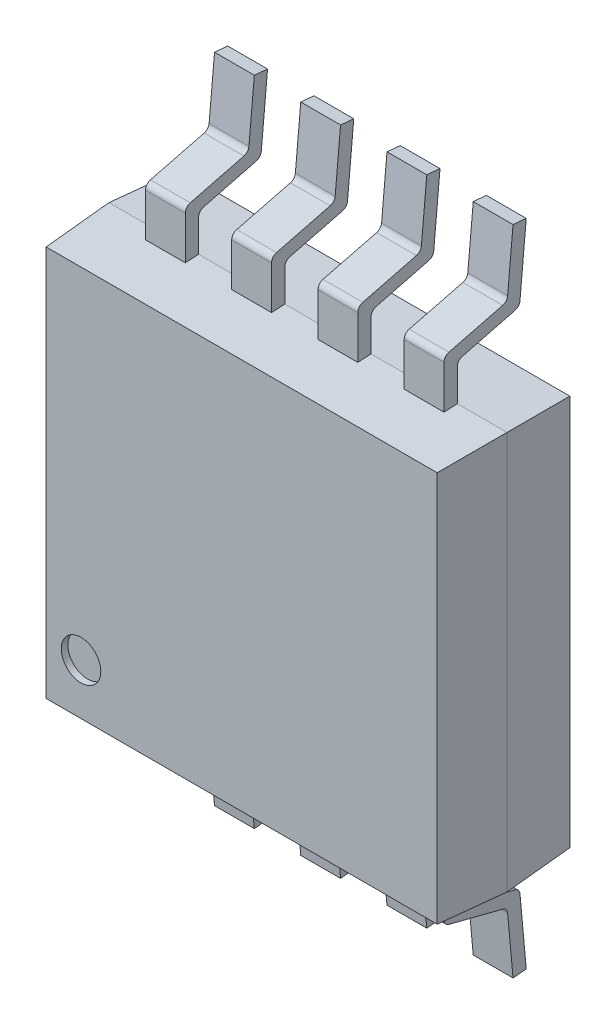
from build123d import *

# Parameters (mm, degrees)
SKETCH1_W              = 3
SKETCH1_H              = 3
BOSS_EXTRUDE1_DEPTH    = 0.5
BOSS_EXTRUDE1_TAPER    = 3
SKETCH2_W              = 3
SKETCH2_H              = 3
BOSS_EXTRUDE2_DEPTH    = 0.5
BOSS_EXTRUDE2_TAPER    = 3
EXTRUDE_THIN1_DEPTH    = 0.15
FILLET1_R              = 0.05
LPATTERN1_COUNT        = 4
LPATTERN1_PITCH        = 0.65
FILLET1_OF_LPATTERN1_R = 0.05
MIRROR1_START          = 0.375
MIRROR1_DEPTH          = 0.3
MIRROR1_START_2        = 1.025
MIRROR1_2_DEPTH        = 0.3
MIRROR1_START_3        = 1.675
MIRROR1_3_DEPTH        = 0.3
MIRROR1_START_4        = 2.325
MIRROR1_4_DEPTH        = 0.3
SKETCH4_R              = 0.14887785
CUT_EXTRUDE1_DEPTH     = 0.05


# Read off the part's stored shape, not the designer's step: Mirror1
with BuildPart() as part:
    # Sketch1 → Boss-Extrude1 (new body)
    with BuildSketch(Plane.XY):
        with Locations((1.5, 1.5)):
            Rectangle(SKETCH1_W, SKETCH1_H)
    extrude(amount=BOSS_EXTRUDE1_DEPTH, taper=BOSS_EXTRUDE1_TAPER)



with BuildPart() as body_2:
    # Sketch2 → Boss-Extrude2 (new body)
    with BuildSketch(Plane(origin=(0, 0, 0), x_dir=(-1, 0, 0), z_dir=(0, 0, -1))):
        with Locations((-1.5, 1.5)):
            Rectangle(SKETCH2_W, SKETCH2_H)
    extrude(amount=BOSS_EXTRUDE2_DEPTH, taper=BOSS_EXTRUDE2_TAPER)


with BuildPart() as part_1:
    add(part.part)

    add(body_2.part)  # Extrude-Thin1 merges body 2
    # Sketch3 → Extrude-Thin1 (add, symmetric)
    with BuildSketch(Plane(origin=(0.525, 0, 0), x_dir=(0, 0, -1), z_dir=(1, 0, 0))):
        Polygon((0, 0.090955067), (0, -0.280409021), (0.469567974, -0.4), (0.52, -0.95), (0.420417762, -0.959131153), (0.376435704, -0.479473015), (-0.1, -0.358132942), (-0.1, 0.090955067), align=None)
    extrude_thin1 = extrude(amount=EXTRUDE_THIN1_DEPTH, both=True)

    # Fillet1
    fillet1_edges = [part_1.edges().sort_by_distance(p)[0] for p in [
        (0.525, -0.280409021, 0),
        (0.525, -0.479473015, -0.376435704),
        (0.525, -0.4, -0.469567974),
        (0.525, -0.358132942, 0.1),
    ]]
    fillet(fillet1_edges, radius=FILLET1_R)

    # LPattern1: Extrude-Thin1 ×4
    with Locations(*[(i * LPATTERN1_PITCH, 0, 0) for i in range(1, LPATTERN1_COUNT)]):
        add(extrude_thin1)

    # Fillet1 of LPattern1
    fillet1_of_lpattern1_edges = [part_1.edges().sort_by_distance(p)[0] for p in [
        (1.175, -0.280409021, 0),
        (1.175, -0.479473015, -0.376435704),
        (1.175, -0.4, -0.469567974),
        (1.175, -0.358132942, 0.1),
        (1.825, -0.280409021, 0),
        (1.825, -0.479473015, -0.376435704),
        (1.825, -0.4, -0.469567974),
        (1.825, -0.358132942, 0.1),
        (2.475, -0.280409021, 0),
        (2.475, -0.479473015, -0.376435704),
        (2.475, -0.4, -0.469567974),
        (2.475, -0.358132942, 0.1),
    ]]
    fillet(fillet1_of_lpattern1_edges, radius=FILLET1_OF_LPATTERN1_R)

    # Mirror1 outline → Mirror1 (add)
    with BuildSketch(Plane.YZ.offset(MIRROR1_START)):
        with BuildLine():
            Line((3, 0), (3.241547061, 0))
            ThreePointArc((3.241547061, 0), (3.272230842, -0.010522088), (3.290000326, -0.037659777))
            Line((3.290000326, -0.037659777), (3.391283242, -0.435342062))
            ThreePointArc((3.391283242, -0.435342062), (3.40728051, -0.461036142), (3.435170931, -0.472792958))
            Line((3.435170931, -0.472792958), (3.95, -0.52))
            Line((3.95, -0.52), (3.959131153, -0.420417762))
            Line((3.959131153, -0.420417762), (3.514643946, -0.379660689))
            ThreePointArc((3.514643946, -0.379660689), (3.486753524, -0.367903873), (3.470756257, -0.342209793))
            Line((3.470756257, -0.342209793), (3.367724246, 0.062340223))
            ThreePointArc((3.367724246, 0.062340223), (3.349954762, 0.089477913), (3.319270981, 0.1))
            Line((3.319270981, 0.1), (2.994759222, 0.1))
            Line((2.994759222, 0.1), (3, 0))
        make_face()
    extrude(amount=MIRROR1_DEPTH)

    # Mirror1 2 outline → Mirror1 2 (add)
    with BuildSketch(Plane.YZ.offset(MIRROR1_START_2)):
        with BuildLine():
            Line((3, 0), (3.241547061, 0))
            ThreePointArc((3.241547061, 0), (3.272230842, -0.010522088), (3.290000326, -0.037659777))
            Line((3.290000326, -0.037659777), (3.391283242, -0.435342062))
            ThreePointArc((3.391283242, -0.435342062), (3.40728051, -0.461036142), (3.435170931, -0.472792958))
            Line((3.435170931, -0.472792958), (3.95, -0.52))
            Line((3.95, -0.52), (3.959131153, -0.420417762))
            Line((3.959131153, -0.420417762), (3.514643946, -0.379660689))
            ThreePointArc((3.514643946, -0.379660689), (3.486753524, -0.367903873), (3.470756257, -0.342209793))
            Line((3.470756257, -0.342209793), (3.367724246, 0.062340223))
            ThreePointArc((3.367724246, 0.062340223), (3.349954762, 0.089477913), (3.319270981, 0.1))
            Line((3.319270981, 0.1), (2.994759222, 0.1))
            Line((2.994759222, 0.1), (3, 0))
        make_face()
    extrude(amount=MIRROR1_2_DEPTH)

    # Mirror1 3 outline → Mirror1 3 (add)
    with BuildSketch(Plane.YZ.offset(MIRROR1_START_3)):
        with BuildLine():
            Line((3, 0), (3.241547061, 0))
            ThreePointArc((3.241547061, 0), (3.272230842, -0.010522088), (3.290000326, -0.037659777))
            Line((3.290000326, -0.037659777), (3.391283242, -0.435342062))
            ThreePointArc((3.391283242, -0.435342062), (3.40728051, -0.461036142), (3.435170931, -0.472792958))
            Line((3.435170931, -0.472792958), (3.95, -0.52))
            Line((3.95, -0.52), (3.959131153, -0.420417762))
            Line((3.959131153, -0.420417762), (3.514643946, -0.379660689))
            ThreePointArc((3.514643946, -0.379660689), (3.486753524, -0.367903873), (3.470756257, -0.342209793))
            Line((3.470756257, -0.342209793), (3.367724246, 0.062340223))
            ThreePointArc((3.367724246, 0.062340223), (3.349954762, 0.089477913), (3.319270981, 0.1))
            Line((3.319270981, 0.1), (2.994759222, 0.1))
            Line((2.994759222, 0.1), (3, 0))
        make_face()
    extrude(amount=MIRROR1_3_DEPTH)

    # Mirror1 4 outline → Mirror1 4 (add)
    with BuildSketch(Plane.YZ.offset(MIRROR1_START_4)):
        with BuildLine():
            Line((3, 0), (3.241547061, 0))
            ThreePointArc((3.241547061, 0), (3.272230842, -0.010522088), (3.290000326, -0.037659777))
            Line((3.290000326, -0.037659777), (3.391283242, -0.435342062))
            ThreePointArc((3.391283242, -0.435342062), (3.40728051, -0.461036142), (3.435170931, -0.472792958))
            Line((3.435170931, -0.472792958), (3.95, -0.52))
            Line((3.95, -0.52), (3.959131153, -0.420417762))
            Line((3.959131153, -0.420417762), (3.514643946, -0.379660689))
            ThreePointArc((3.514643946, -0.379660689), (3.486753524, -0.367903873), (3.470756257, -0.342209793))
            Line((3.470756257, -0.342209793), (3.367724246, 0.062340223))
            ThreePointArc((3.367724246, 0.062340223), (3.349954762, 0.089477913), (3.319270981, 0.1))
            Line((3.319270981, 0.1), (2.994759222, 0.1))
            Line((2.994759222, 0.1), (3, 0))
        make_face()
    extrude(amount=MIRROR1_4_DEPTH)

    # Sketch4 → Cut-Extrude1 (cut)
    with BuildSketch(Plane.XY.offset(0.5)):
        with Locations((0.289126817, 0.408229097)):
            Circle(SKETCH4_R)
    extrude(amount=-CUT_EXTRUDE1_DEPTH, mode=Mode.SUBTRACT)


solid = part_1.part
